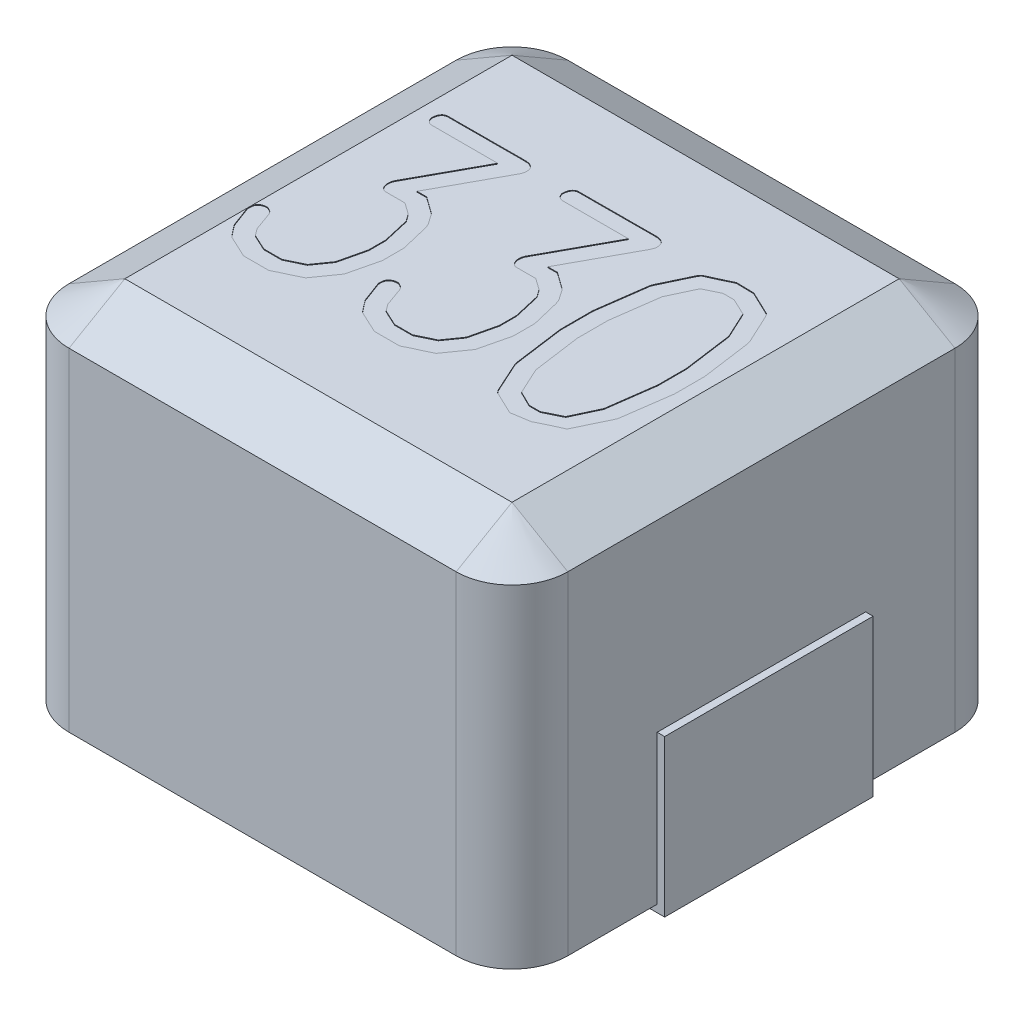
from build123d import *

# Parameters (mm, degrees)
BOSS_EXTRUDE1_DEPTH      = 4.9
BOSS_EXTRUDE3_DEPTH      = 0.1
BOSS_EXTRUDE3_DEPTH_BACK = 2
SKETCH4_W                = 1.45
SKETCH4_H                = 2.8
CHAMFER1_SIZE            = 0.75
CHAMFER1_SIZE_2          = 0.433012702
CUT_EXTRUDE1_DEPTH       = 0.01


with BuildPart() as part:
    # Sketch1 → Boss-Extrude1 (new body)
    with BuildSketch(Plane(origin=(0, 0, 0), x_dir=(1, 0, 0), z_dir=(0, 1, 0))):
        with BuildLine():
            Line((2.6, -3.35), (-2.6, -3.35))
            ThreePointArc((-2.6, -3.35), (-3.130330086, -3.130330086), (-3.35, -2.6))
            Line((-3.35, -2.6), (-3.35, 2.6))
            ThreePointArc((-3.35, 2.6), (-3.130330086, 3.130330086), (-2.6, 3.35))
            Line((-2.6, 3.35), (2.6, 3.35))
            ThreePointArc((2.6, 3.35), (3.130330086, 3.130330086), (3.35, 2.6))
            Line((3.35, 2.6), (3.35, -2.6))
            ThreePointArc((3.35, -2.6), (3.130330086, -3.130330086), (2.6, -3.35))
        make_face()
    extrude(amount=BOSS_EXTRUDE1_DEPTH)

    # Sketch4 → Boss-Extrude3 (add, two sides: drawn at the far end of the back side and taken through both)
    with BuildSketch(Plane.XZ.offset(-BOSS_EXTRUDE3_DEPTH_BACK)):
        with Locations((-2.725, 0)):
            Rectangle(SKETCH4_W, SKETCH4_H)
        with Locations((2.725, 0)):
            Rectangle(SKETCH4_W, SKETCH4_H)
    extrude(amount=BOSS_EXTRUDE3_DEPTH + BOSS_EXTRUDE3_DEPTH_BACK)

    # Chamfer1
    # the kernel refuses this chamfer: 0.75, 0.433012702 mm, written as the material it takes off along each edge
    with BuildSketch(Plane(origin=(2.6, 4.9, -2.6), x_dir=(0, 0, -1), z_dir=(-1, 0, 0))) as chamfer1_piece_1:
        Polygon((0.75 - CHAMFER1_SIZE, 0), (0.75, CHAMFER1_SIZE_2), (0.75, 0), align=None)
    revolve(axis=Axis((2.6, 4.9, -2.6), (0, -1, 0)), revolution_arc=90, mode=Mode.SUBTRACT)
    with BuildSketch(Plane(origin=(-2.6, 4.9, -3.35), x_dir=(0, 0, 1), z_dir=(1, 0, 0)), Plane(origin=(-3.35, 4.9, 2.6), x_dir=(1, 0, 0), z_dir=(0, 0, -1)), Plane(origin=(3.35, 4.9, -2.6), x_dir=(-1, 0, 0), z_dir=(0, 0, 1))) as chamfer1_piece_2:
        Polygon((CHAMFER1_SIZE, 0), (0, CHAMFER1_SIZE_2), (0, 0), align=None)
    extrude(amount=5.2, mode=Mode.SUBTRACT)
    with BuildSketch(Plane(origin=(-2.6, 4.9, -2.6), x_dir=(-1, 0, 0), z_dir=(0, 0, 1))) as chamfer1_piece_3:
        Polygon((0.75 - CHAMFER1_SIZE, 0), (0.75, CHAMFER1_SIZE_2), (0.75, 0), align=None)
    revolve(axis=Axis((-2.6, 4.9, -2.6), (0, -1, 0)), revolution_arc=90, mode=Mode.SUBTRACT)
    with BuildSketch(Plane(origin=(-2.6, 4.9, 2.6), x_dir=(0, 0, 1), z_dir=(1, 0, 0))) as chamfer1_piece_4:
        Polygon((0.75, CHAMFER1_SIZE_2), (0.75 - CHAMFER1_SIZE, 0), (0.75, 0), align=None)
    revolve(axis=Axis((-2.6, 4.9, 2.6), (0, -1, 0)), revolution_arc=90, mode=Mode.SUBTRACT)
    with BuildSketch(Plane(origin=(2.6, 4.9, 3.35), x_dir=(0, -1, 0), z_dir=(-1, 0, 0))) as chamfer1_piece_5:
        Polygon((CHAMFER1_SIZE_2, 0), (0, -CHAMFER1_SIZE), (0, 0), align=None)
    extrude(amount=5.2, mode=Mode.SUBTRACT)
    with BuildSketch(Plane(origin=(2.6, 4.9, 2.6), x_dir=(1, 0, 0), z_dir=(0, 0, -1))) as chamfer1_piece_6:
        Polygon((0.75, CHAMFER1_SIZE_2), (0.75 - CHAMFER1_SIZE, 0), (0.75, 0), align=None)
    revolve(axis=Axis((2.6, 4.9, 2.6), (0, -1, 0)), revolution_arc=90, mode=Mode.SUBTRACT)

    # Sketch5 → Cut-Extrude1 (cut)
    # profile 1 of 3: a face of its own
    with BuildSketch(Plane(origin=(0, 4.9, 0), x_dir=(1, 0, 0), z_dir=(0, 1, 0))):
        with BuildLine():
            add(Edge.make_bspline(
                [(-1.149698795, 1.34186747), (-1.149983238, 1.335603153), (-1.150599032, 1.322041479), (-1.158152743, 1.300773556), (-1.167015844, 1.275978138), (-1.176342164, 1.259292039), (-1.181325301, 1.250376506)],
                knots=[0, 0, 0, 0, 0.766033791, 1.658393374, 2.748858461, 4, 4, 4, 4], degree=3))
            add(Edge.make_bspline(
                [(-1.181325301, 1.250376506), (-1.18620535, 1.241332314), (-1.194445769, 1.226060351), (-1.204758828, 1.207316024), (-1.210399698, 1.196767173), (-1.212576555, 1.192395217), (-1.212951807, 1.191641566)],
                knots=[0, 0, 0, 0, 1.848571161, 3.121485335, 3.84855915, 4, 4, 4, 4], degree=3))
            Line((-1.212951807, 1.191641566), (-1.655158133, 0.379518072))
            Line((-1.655158133, 0.379518072), (-1.525828313, 0.379518072))
            add(Edge.make_bspline(
                [(-1.525828313, 0.379518072), (-1.511734829, 0.369316654), (-1.480463142, 0.346680977), (-1.428128994, 0.310123444), (-1.366813562, 0.265918702), (-1.322531223, 0.234352316), (-1.298795181, 0.217432229)],
                knots=[0, 0, 0, 0, 0.748413374, 1.660636079, 2.746063501, 4, 4, 4, 4], degree=3))
            Line((-1.298795181, 0.217432229), (-1.19939759, 0.074548193))
            add(Edge.make_bspline(
                [(-1.19939759, 0.074548193), (-1.196840263, 0.070273308), (-1.190723781, 0.060048861), (-1.183321815, 0.040498793), (-1.174741758, 0.014917616), (-1.169533241, -0.004479543), (-1.166641566, -0.015248494)],
                knots=[0, 0, 0, 0, 0.622275034, 1.488325126, 2.605563708, 4, 4, 4, 4], degree=3))
            add(Edge.make_bspline(
                [(-1.166641566, -0.015248494), (-1.161356275, -0.037270696), (-1.149613448, -0.086199485), (-1.130577875, -0.167045059), (-1.107205862, -0.262391888), (-1.090744709, -0.330941352), (-1.081927711, -0.367658133)],
                knots=[0, 0, 0, 0, 0.749817199, 1.665939072, 2.749819494, 4, 4, 4, 4], degree=3))
            Line((-1.081927711, -0.367658133), (-1.081927711, -0.660203313))
            add(Edge.make_bspline(
                [(-1.081927711, -0.660203313), (-1.091483569, -0.699182614), (-1.10981253, -0.773948272), (-1.136868834, -0.881225728), (-1.159527531, -0.979327663), (-1.174327618, -1.041423415), (-1.181325301, -1.070783133)],
                knots=[0, 0, 0, 0, 1.140038679, 2.186692469, 3.142643496, 4, 4, 4, 4], degree=3))
            add(Edge.make_bspline(
                [(-1.181325301, -1.070783133), (-1.184122695, -1.075130738), (-1.191385193, -1.086417842), (-1.205704043, -1.106487353), (-1.224614117, -1.134173687), (-1.249370337, -1.168671262), (-1.278061482, -1.211072454), (-1.313826666, -1.259541403), (-1.353407156, -1.316009284), (-1.381962828, -1.35582678), (-1.397063253, -1.37688253)],
                knots=[0, 0, 0, 0, 0.33126985, 0.860031464, 1.579543678, 2.479919522, 3.580933085, 4.859959145, 6.339525998, 8, 8, 8, 8], degree=3))
            add(Edge.make_bspline(
                [(-1.397063253, -1.37688253), (-1.409079145, -1.383159087), (-1.434454124, -1.396413825), (-1.475445604, -1.416102904), (-1.520936325, -1.437527775), (-1.569583095, -1.459386972), (-1.617544534, -1.479907176), (-1.660044919, -1.500948056), (-1.696727325, -1.518190957), (-1.718286723, -1.530563426), (-1.728012048, -1.536144578)],
                knots=[0, 0, 0, 0, 0.885494469, 1.869973812, 2.970225745, 4.170147024, 5.353826682, 6.376874414, 7.267817083, 8, 8, 8, 8], degree=3))
            Line((-1.728012048, -1.536144578), (-2.069126506, -1.536144578))
            add(Edge.make_bspline(
                [(-2.069126506, -1.536144578), (-2.088168538, -1.52773594), (-2.130172073, -1.509187892), (-2.198686583, -1.477121672), (-2.279227273, -1.439614419), (-2.336667014, -1.411967445), (-2.367319277, -1.397213855)],
                knots=[0, 0, 0, 0, 0.759260437, 1.674801466, 2.759176188, 4, 4, 4, 4], degree=3))
            add(Edge.make_bspline(
                [(-2.367319277, -1.397213855), (-2.369597461, -1.394783687), (-2.375255718, -1.388747951), (-2.384593832, -1.377563558), (-2.396596782, -1.36265422), (-2.411257796, -1.343997027), (-2.428619515, -1.321626764), (-2.448496107, -1.295399024), (-2.470962934, -1.265703415), (-2.486687955, -1.244552873), (-2.494954819, -1.233433735)],
                knots=[0, 0, 0, 0, 0.384832085, 0.95579607, 1.682781473, 2.596624199, 3.697412724, 4.95470817, 6.399047221, 8, 8, 8, 8], degree=3))
            Line((-2.494954819, -1.233433735), (-2.598870482, -0.953878012))
            Line((-2.598870482, -0.953878012), (-2.6, -0.924510542))
            add(Edge.make_bspline(
                [(-2.6, -0.924510542), (-2.599294848, -0.910034189), (-2.597977012, -0.882979771), (-2.584322579, -0.859669962), (-2.577974398, -0.848832831)],
                knots=[0, 0, 0, 0, 1.070165585, 2, 2, 2, 2], degree=3))
            add(Edge.make_bspline(
                [(-2.577974398, -0.848832831), (-2.571274862, -0.842625479), (-2.557747627, -0.830092027), (-2.531908716, -0.817787917), (-2.502543486, -0.810267409), (-2.481641012, -0.809632786), (-2.470670181, -0.809299699)],
                knots=[0, 0, 0, 0, 0.927235859, 1.872210037, 2.883212335, 4, 4, 4, 4], degree=3))
            add(Edge.make_bspline(
                [(-2.470670181, -0.809299699), (-2.459630677, -0.814325553), (-2.439177787, -0.823636954), (-2.412680448, -0.839965004), (-2.393893142, -0.859131183), (-2.386947577, -0.873660236), (-2.383697289, -0.880459337)],
                knots=[0, 0, 0, 0, 1.260219348, 2.334808465, 3.220747219, 4, 4, 4, 4], degree=3))
            Line((-2.383697289, -0.880459337), (-2.293900602, -1.13064759))
            Line((-2.293900602, -1.13064759), (-2.226129518, -1.221009036))
            Line((-2.226129518, -1.221009036), (-2.01434488, -1.319277108))
            Line((-2.01434488, -1.319277108), (-1.772063253, -1.319277108))
            Line((-1.772063253, -1.319277108), (-1.53938253, -1.20689006))
            Line((-1.53938253, -1.20689006), (-1.383509036, -0.984939759))
            Line((-1.383509036, -0.984939759), (-1.298795181, -0.625188253))
            Line((-1.298795181, -0.625188253), (-1.298795181, -0.396460843))
            Line((-1.298795181, -0.396460843), (-1.380685241, -0.040097892))
            Line((-1.380685241, -0.040097892), (-1.449585843, 0.055911145))
            Line((-1.449585843, 0.055911145), (-1.600376506, 0.162650602))
            Line((-1.600376506, 0.162650602), (-1.870331325, 0.162650602))
            add(Edge.make_bspline(
                [(-1.870331325, 0.162650602), (-1.880532704, 0.166883848), (-1.900784953, 0.175287882), (-1.924269028, 0.200062475), (-1.939243677, 0.233021988), (-1.94290356, 0.257739459), (-1.944879518, 0.271084337)],
                knots=[0, 0, 0, 0, 0.939069473, 1.864284095, 2.846934223, 4, 4, 4, 4], degree=3))
            add(Edge.make_bspline(
                [(-1.944879518, 0.271084337), (-1.944602188, 0.286738492), (-1.944114925, 0.314242443), (-1.933992268, 0.33973301), (-1.929631024, 0.350715361)],
                knots=[0, 0, 0, 0, 1.13832041, 2, 2, 2, 2], degree=3))
            Line((-1.929631024, 0.350715361), (-1.43998494, 1.246987952))
            Line((-1.43998494, 1.246987952), (-2.332304217, 1.246987952))
            add(Edge.make_bspline(
                [(-2.332304217, 1.246987952), (-2.342184717, 1.249339116), (-2.361456348, 1.253924993), (-2.385498058, 1.272058116), (-2.403265357, 1.297241603), (-2.40965829, 1.317143686), (-2.413064759, 1.327748494)],
                knots=[0, 0, 0, 0, 0.995634266, 1.941955788, 2.90337285, 4, 4, 4, 4], degree=3))
            add(Edge.make_bspline(
                [(-2.413064759, 1.327748494), (-2.41265928, 1.341184266), (-2.411900046, 1.366341953), (-2.402928132, 1.40060865), (-2.388251594, 1.429214111), (-2.373066839, 1.442228672), (-2.365625, 1.448606928)],
                knots=[0, 0, 0, 0, 1.193182589, 2.234163648, 3.134587983, 4, 4, 4, 4], degree=3))
            Line((-2.365625, 1.448606928), (-2.334563253, 1.460466867))
            Line((-2.334563253, 1.460466867), (-1.293712349, 1.463855422))
            add(Edge.make_bspline(
                [(-1.293712349, 1.463855422), (-1.282393598, 1.463611363), (-1.261097981, 1.46315218), (-1.231443256, 1.457706237), (-1.206259955, 1.44798158), (-1.185588353, 1.434337369), (-1.16903926, 1.416885623), (-1.157625606, 1.395228839), (-1.150781973, 1.369762591), (-1.150073401, 1.351514696), (-1.149698795, 1.34186747)],
                knots=[0, 0, 0, 0, 1.256822572, 2.364643423, 3.331995083, 4.237171964, 5.095694252, 5.975616801, 6.92975701, 8, 8, 8, 8], degree=3))
        make_face()
    # profile 2 of 3: a face of its own
    with BuildSketch(Plane(origin=(0, 4.9, 0), x_dir=(1, 0, 0), z_dir=(0, 1, 0))):
        with BuildLine():
            add(Edge.make_bspline(
                [(0.606927711, 1.34186747), (0.606643268, 1.335603153), (0.606027474, 1.322041479), (0.598473763, 1.300773556), (0.589610662, 1.275978138), (0.580284342, 1.259292039), (0.575301205, 1.250376506)],
                knots=[0, 0, 0, 0, 0.766033791, 1.658393374, 2.748858461, 4, 4, 4, 4], degree=3))
            add(Edge.make_bspline(
                [(0.575301205, 1.250376506), (0.570421156, 1.241332314), (0.562180737, 1.226060351), (0.551867678, 1.207316024), (0.546226808, 1.196767173), (0.544049951, 1.192395217), (0.543674699, 1.191641566)],
                knots=[0, 0, 0, 0, 1.848571161, 3.121485335, 3.84855915, 4, 4, 4, 4], degree=3))
            Line((0.543674699, 1.191641566), (0.101468373, 0.379518072))
            Line((0.101468373, 0.379518072), (0.230798193, 0.379518072))
            add(Edge.make_bspline(
                [(0.230798193, 0.379518072), (0.244891677, 0.369316654), (0.276163364, 0.346680977), (0.328497512, 0.310123444), (0.389812944, 0.265918702), (0.434095283, 0.234352316), (0.457831325, 0.217432229)],
                knots=[0, 0, 0, 0, 0.748413374, 1.660636079, 2.746063501, 4, 4, 4, 4], degree=3))
            Line((0.457831325, 0.217432229), (0.557228916, 0.074548193))
            add(Edge.make_bspline(
                [(0.557228916, 0.074548193), (0.559786243, 0.070273308), (0.565902725, 0.060048861), (0.573304691, 0.040498793), (0.581884748, 0.014917616), (0.587093265, -0.004479543), (0.58998494, -0.015248494)],
                knots=[0, 0, 0, 0, 0.622275034, 1.488325126, 2.605563708, 4, 4, 4, 4], degree=3))
            add(Edge.make_bspline(
                [(0.58998494, -0.015248494), (0.595270231, -0.037270696), (0.607013058, -0.086199485), (0.626048631, -0.167045059), (0.649420644, -0.262391888), (0.665881797, -0.330941352), (0.674698795, -0.367658133)],
                knots=[0, 0, 0, 0, 0.749817199, 1.665939072, 2.749819494, 4, 4, 4, 4], degree=3))
            Line((0.674698795, -0.367658133), (0.674698795, -0.660203313))
            add(Edge.make_bspline(
                [(0.674698795, -0.660203313), (0.665142937, -0.699182614), (0.646813976, -0.773948272), (0.619757672, -0.881225728), (0.597098975, -0.979327663), (0.582298888, -1.041423415), (0.575301205, -1.070783133)],
                knots=[0, 0, 0, 0, 1.140038679, 2.186692469, 3.142643496, 4, 4, 4, 4], degree=3))
            add(Edge.make_bspline(
                [(0.575301205, -1.070783133), (0.572503811, -1.075130738), (0.565241313, -1.086417842), (0.550922463, -1.106487353), (0.532012389, -1.134173687), (0.507256169, -1.168671262), (0.478565024, -1.211072454), (0.44279984, -1.259541403), (0.40321935, -1.316009284), (0.374663678, -1.35582678), (0.359563253, -1.37688253)],
                knots=[0, 0, 0, 0, 0.33126985, 0.860031464, 1.579543678, 2.479919522, 3.580933085, 4.859959145, 6.339525998, 8, 8, 8, 8], degree=3))
            add(Edge.make_bspline(
                [(0.359563253, -1.37688253), (0.347547361, -1.383159087), (0.322172382, -1.396413825), (0.281180902, -1.416102904), (0.235690181, -1.437527775), (0.187043411, -1.459386972), (0.139081972, -1.479907176), (0.096581587, -1.500948056), (0.059899181, -1.518190957), (0.038339783, -1.530563426), (0.028614458, -1.536144578)],
                knots=[0, 0, 0, 0, 0.885494469, 1.869973812, 2.970225745, 4.170147024, 5.353826682, 6.376874414, 7.267817083, 8, 8, 8, 8], degree=3))
            Line((0.028614458, -1.536144578), (-0.3125, -1.536144578))
            add(Edge.make_bspline(
                [(-0.3125, -1.536144578), (-0.331542032, -1.52773594), (-0.373545566, -1.509187892), (-0.442060077, -1.477121672), (-0.522600767, -1.439614419), (-0.580040508, -1.411967445), (-0.610692771, -1.397213855)],
                knots=[0, 0, 0, 0, 0.759260437, 1.674801466, 2.759176188, 4, 4, 4, 4], degree=3))
            add(Edge.make_bspline(
                [(-0.610692771, -1.397213855), (-0.612970955, -1.394783687), (-0.618629212, -1.388747951), (-0.627967326, -1.377563558), (-0.639970276, -1.36265422), (-0.65463129, -1.343997027), (-0.671993009, -1.321626764), (-0.691869601, -1.295399024), (-0.714336428, -1.265703415), (-0.730061449, -1.244552873), (-0.738328313, -1.233433735)],
                knots=[0, 0, 0, 0, 0.384832085, 0.95579607, 1.682781473, 2.596624199, 3.697412724, 4.95470817, 6.399047221, 8, 8, 8, 8], degree=3))
            Line((-0.738328313, -1.233433735), (-0.842243976, -0.953878012))
            Line((-0.842243976, -0.953878012), (-0.843373494, -0.924510542))
            add(Edge.make_bspline(
                [(-0.843373494, -0.924510542), (-0.842668342, -0.910034189), (-0.841350506, -0.882979771), (-0.827696073, -0.859669962), (-0.821347892, -0.848832831)],
                knots=[0, 0, 0, 0, 1.070165585, 2, 2, 2, 2], degree=3))
            add(Edge.make_bspline(
                [(-0.821347892, -0.848832831), (-0.814648356, -0.842625479), (-0.801121121, -0.830092027), (-0.77528221, -0.817787917), (-0.74591698, -0.810267409), (-0.725014506, -0.809632786), (-0.714043675, -0.809299699)],
                knots=[0, 0, 0, 0, 0.927235859, 1.872210037, 2.883212335, 4, 4, 4, 4], degree=3))
            add(Edge.make_bspline(
                [(-0.714043675, -0.809299699), (-0.703004171, -0.814325553), (-0.682551281, -0.823636954), (-0.656053942, -0.839965004), (-0.637266636, -0.859131183), (-0.630321071, -0.873660236), (-0.627070783, -0.880459337)],
                knots=[0, 0, 0, 0, 1.260219348, 2.334808465, 3.220747219, 4, 4, 4, 4], degree=3))
            Line((-0.627070783, -0.880459337), (-0.537274096, -1.13064759))
            Line((-0.537274096, -1.13064759), (-0.469503012, -1.221009036))
            Line((-0.469503012, -1.221009036), (-0.257718373, -1.319277108))
            Line((-0.257718373, -1.319277108), (-0.015436747, -1.319277108))
            Line((-0.015436747, -1.319277108), (0.217243976, -1.20689006))
            Line((0.217243976, -1.20689006), (0.37311747, -0.984939759))
            Line((0.37311747, -0.984939759), (0.457831325, -0.625188253))
            Line((0.457831325, -0.625188253), (0.457831325, -0.396460843))
            Line((0.457831325, -0.396460843), (0.375941265, -0.040097892))
            Line((0.375941265, -0.040097892), (0.307040663, 0.055911145))
            Line((0.307040663, 0.055911145), (0.15625, 0.162650602))
            Line((0.15625, 0.162650602), (-0.113704819, 0.162650602))
            add(Edge.make_bspline(
                [(-0.113704819, 0.162650602), (-0.123906198, 0.166883848), (-0.144158447, 0.175287882), (-0.167642522, 0.200062475), (-0.182617171, 0.233021988), (-0.186277054, 0.257739459), (-0.188253012, 0.271084337)],
                knots=[0, 0, 0, 0, 0.939069473, 1.864284095, 2.846934223, 4, 4, 4, 4], degree=3))
            add(Edge.make_bspline(
                [(-0.188253012, 0.271084337), (-0.187975682, 0.286738492), (-0.187488419, 0.314242443), (-0.177365762, 0.33973301), (-0.173004518, 0.350715361)],
                knots=[0, 0, 0, 0, 1.13832041, 2, 2, 2, 2], degree=3))
            Line((-0.173004518, 0.350715361), (0.316641566, 1.246987952))
            Line((0.316641566, 1.246987952), (-0.575677711, 1.246987952))
            add(Edge.make_bspline(
                [(-0.575677711, 1.246987952), (-0.585558211, 1.249339116), (-0.604829841, 1.253924993), (-0.628871552, 1.272058116), (-0.646638851, 1.297241603), (-0.653031784, 1.317143686), (-0.656438253, 1.327748494)],
                knots=[0, 0, 0, 0, 0.995634266, 1.941955788, 2.90337285, 4, 4, 4, 4], degree=3))
            add(Edge.make_bspline(
                [(-0.656438253, 1.327748494), (-0.656032774, 1.341184266), (-0.65527354, 1.366341953), (-0.646301626, 1.40060865), (-0.631625088, 1.429214111), (-0.616440333, 1.442228672), (-0.608998494, 1.448606928)],
                knots=[0, 0, 0, 0, 1.193182589, 2.234163648, 3.134587983, 4, 4, 4, 4], degree=3))
            Line((-0.608998494, 1.448606928), (-0.577936747, 1.460466867))
            Line((-0.577936747, 1.460466867), (0.462914157, 1.463855422))
            add(Edge.make_bspline(
                [(0.462914157, 1.463855422), (0.474232908, 1.463611363), (0.495528525, 1.46315218), (0.52518325, 1.457706237), (0.550366551, 1.44798158), (0.571038153, 1.434337369), (0.587587246, 1.416885623), (0.5990009, 1.395228839), (0.605844533, 1.369762591), (0.606553105, 1.351514696), (0.606927711, 1.34186747)],
                knots=[0, 0, 0, 0, 1.256822572, 2.364643423, 3.331995083, 4.237171964, 5.095694252, 5.975616801, 6.92975701, 8, 8, 8, 8], degree=3))
        make_face()
    # profile 3 of 3: a face of its own
    with BuildSketch(Plane(origin=(0, 4.9, 0), x_dir=(1, 0, 0), z_dir=(0, 1, 0))):
        with BuildLine():
            add(Edge.make_bspline(
                [(1.789194277, 1.45877259), (1.798225841, 1.454245461), (1.817568714, 1.44454972), (1.848378629, 1.429354098), (1.883357891, 1.41291638), (1.921932913, 1.394432585), (1.964534018, 1.373822704), (2.011188043, 1.352125159), (2.061550431, 1.328215646), (2.096414467, 1.311916723), (2.114495482, 1.303463855)],
                knots=[0, 0, 0, 0, 0.672609136, 1.440525024, 2.287058542, 3.245674053, 4.288353812, 5.437736142, 6.671171322, 8, 8, 8, 8], degree=3))
            Line((2.114495482, 1.303463855), (2.143298193, 1.262801205))
            Line((2.143298193, 1.262801205), (2.329103916, 0.862951807))
            Line((2.329103916, 0.862951807), (2.338704819, 0.826807229))
            Line((2.338704819, 0.826807229), (2.431325301, 0.156438253))
            Line((2.431325301, 0.156438253), (2.431325301, -0.249058735))
            Line((2.431325301, -0.249058735), (2.335881024, -0.929593373))
            Line((2.335881024, -0.929593373), (2.327974398, -0.939759036))
            Line((2.327974398, -0.939759036), (2.124096386, -1.365587349))
            Line((2.124096386, -1.365587349), (2.106024096, -1.383659639))
            add(Edge.make_bspline(
                [(2.106024096, -1.383659639), (2.094879247, -1.388088585), (2.070498738, -1.397777363), (2.032122047, -1.41543667), (1.988358086, -1.435768563), (1.941903374, -1.458465971), (1.896575949, -1.481716602), (1.855248761, -1.500887891), (1.821403153, -1.518108227), (1.801059636, -1.52824901), (1.792018072, -1.532756024)],
                knots=[0, 0, 0, 0, 0.827651576, 1.81057338, 2.915068925, 4.158703476, 5.379039228, 6.43099689, 7.302665284, 8, 8, 8, 8], degree=3))
            Line((1.792018072, -1.532756024), (1.541829819, -1.572289157))
            add(Edge.make_bspline(
                [(1.541829819, -1.572289157), (1.52144749, -1.563364305), (1.47684153, -1.543832605), (1.405124406, -1.509291225), (1.321584164, -1.469689801), (1.262589153, -1.440073744), (1.231212349, -1.424322289)],
                knots=[0, 0, 0, 0, 0.775902592, 1.698033599, 2.775687197, 4, 4, 4, 4], degree=3))
            Line((1.231212349, -1.424322289), (1.203539157, -1.391001506))
            Line((1.203539157, -1.391001506), (1.012650602, -0.971950301))
            Line((1.012650602, -0.971950301), (1.005308735, -0.941453313))
            Line((1.005308735, -0.941453313), (0.913253012, -0.26374247))
            Line((0.913253012, -0.26374247), (0.913253012, 0.171686747))
            Line((0.913253012, 0.171686747), (1.005873494, 0.847703313))
            Line((1.005873494, 0.847703313), (1.014909639, 0.874811747))
            Line((1.014909639, 0.874811747), (1.209751506, 1.285956325))
            Line((1.209751506, 1.285956325), (1.235165663, 1.316453313))
            add(Edge.make_bspline(
                [(1.235165663, 1.316453313), (1.245525105, 1.320769529), (1.268183077, 1.330209873), (1.304863612, 1.345863501), (1.346731973, 1.365332042), (1.392315632, 1.386931377), (1.437925419, 1.409630222), (1.480512068, 1.429482868), (1.517701365, 1.44735654), (1.540694988, 1.458218982), (1.551430723, 1.463290663)],
                knots=[0, 0, 0, 0, 0.772324666, 1.689213553, 2.744240256, 3.949553191, 5.160492455, 6.249955038, 7.182903063, 8, 8, 8, 8], degree=3))
            Line((1.551430723, 1.463290663), (1.789194277, 1.45877259))
        make_face()
        Polygon((1.960881024, 1.140813253), (1.736671687, 1.246987952), (1.587010542, 1.246987952), (1.380308735, 1.147590361), (1.217658133, 0.798569277), (1.130120482, 0.161521084), (1.130120482, -0.253012048), (1.219917169, -0.900225904), (1.384262048, -1.256588855), (1.586445783, -1.355421687), (1.733847892, -1.355421687), (1.963704819, -1.24246988), (2.12748494, -0.891189759), (2.214457831, -0.253576807), (2.214457831, 0.127635542), (2.124096386, 0.788403614), align=None, mode=Mode.SUBTRACT)
    extrude(amount=-CUT_EXTRUDE1_DEPTH, mode=Mode.SUBTRACT)


solid = part.part
